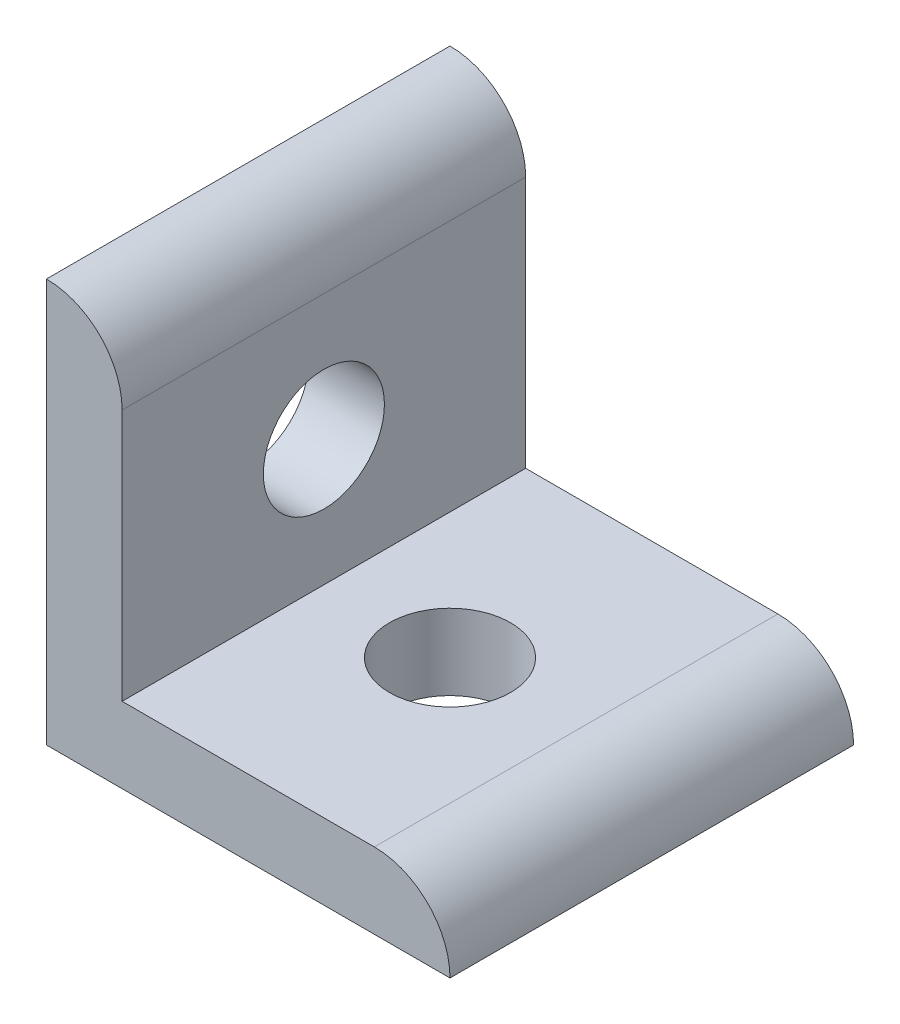
from build123d import *

# Parameters (mm, degrees)
SKETCH2_W           = 25.4
SKETCH2_H           = 25.4
BOSS_EXTRUDE1_DEPTH = 25.4
SHELL1_T            = -4.7625
FILLET1_R           = 4.7625
SKETCH3_R           = 3.81
CUT_EXTRUDE1_DEPTH  = 25.4


with BuildPart() as part:
    # Sketch2 → Boss-Extrude1 (new body)
    with BuildSketch(Plane.XY):
        with Locations((12.7, 12.7)):
            Rectangle(SKETCH2_W, SKETCH2_H)
    extrude(amount=BOSS_EXTRUDE1_DEPTH)

    # Shell1
    shell1_openings = [part.faces().sort_by_distance(p)[0] for p in [
        (12.7, 12.7, 25.4),
        (12.7, 12.7, 0),
        (12.7, 25.4, 12.7),
        (25.4, 12.7, 12.7),
    ]]
    offset(amount=SHELL1_T, openings=shell1_openings, kind=Kind.INTERSECTION)

    # Fillet1
    fillet1_edges = [part.edges().sort_by_distance(p)[0] for p in [
        (25.4, 4.7625, 12.7),
        (4.7625, 25.4, 12.7),
    ]]
    fillet(fillet1_edges, radius=FILLET1_R - 0.0001)  # a hair under: the kernel refuses the full size

    # Sketch3 → Cut-Extrude1 (cut)
    with BuildSketch(Plane.ZY):
        with Locations((12.7, 12.7)):
            Circle(SKETCH3_R)
    cut_extrude1 = extrude(amount=-CUT_EXTRUDE1_DEPTH, mode=Mode.SUBTRACT)

    # Mirror1: Cut-Extrude1 across plane
    add(cut_extrude1.mirror(Plane(origin=(0, 0, 0), x_dir=(0, 0, 1), z_dir=(-0.7071067811865475, 0.7071067811865477, 0))), mode=Mode.SUBTRACT)


solid = part.part
